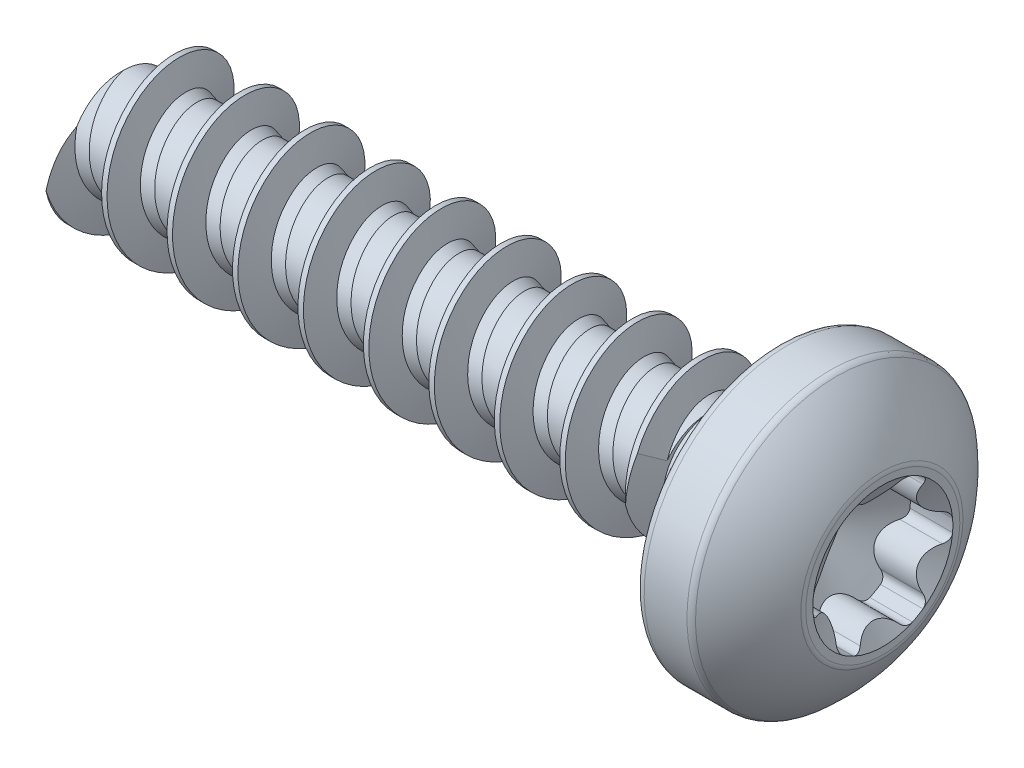
from build123d import *

# Parameters (mm, degrees)
BOSS_EXTRUDE1_REACH = 17.248
SKETCH3_R           = 1.49479
SKETCH9_W           = 11.43
SKETCH9_H           = 1.5367
CUT_SWEEP1_PITCH    = 1.27


# Read off the part's stored shape, not the designer's step: Split1
with BuildPart() as part:
    # Sketch2 → Revolve1 (revolve)
    with BuildSketch(Plane.XY):
        with BuildLine():
            Line((-7.366, 0), (7.366, 0))
            Line((7.366, 0), (7.366, 1.49479))
            ThreePointArc((7.366, 1.49479), (7.361453422, 1.535315115), (7.348039754, 1.57382524))
            ThreePointArc((7.348039754, 1.57382524), (6.966551479, 2.199326693), (6.467579747, 2.735808362))
            ThreePointArc((6.467579747, 2.735808362), (6.411371594, 2.769549597), (6.346875429, 2.7813))
            Line((6.346875429, 2.7813), (5.51688, 2.7813))
            ThreePointArc((5.51688, 2.7813), (5.387564312, 2.727735688), (5.334, 2.59842))
            Line((5.334, 2.59842), (5.334, 1.380701667))
            ThreePointArc((5.334, 1.380701667), (5.226871376, 1.12207029), (4.96824, 1.014941667))
            Line((4.96824, 1.014941667), (4.261487689, 1.014941667))
            Line((4.261487689, 1.014941667), (4.064, 0.962025))
            Line((4.064, 0.962025), (-7.366, 0.962025))
            Line((-7.366, 0.962025), (-7.366, 0))
        make_face()
    revolve(axis=Axis((-7.366, 0, 0), (-1, 0, 0)))

    # Sketch12 → Cut-Revolve3 (revolve, cut)
    with BuildSketch(Plane.XY, mode=Mode.PRIVATE) as cut_revolve3_sk:
        Polygon((7.366, 1.3589), (6.5405, 1.3589), (5.755938719, 0), (7.366, 0), align=None)
    revolve(cut_revolve3_sk.sketch.rotate(Axis((-7.366, 0, 0), (1, 0, 0)), 90), axis=Axis((-7.366, 0, 0), (1, 0, 0)), mode=Mode.SUBTRACT)

    # Boss-Extrude1: up to this cone (the profile starts inside it)
    boss_extrude1_end = Plane(origin=(7.366, 0, 0), z_dir=(1, 0, 0)).offset(-1.610060281) * Cone(1.732e-06, 38.359329517, 22.146768222, align=(Align.CENTER, Align.CENTER, Align.MIN), mode=Mode.PRIVATE)
    # Sketch3 → Boss-Extrude1 (add, up to the surface)
    with BuildSketch(Plane(origin=(7.366, 0, 0), x_dir=(0, 0, -1), z_dir=(1, 0, 0)), mode=Mode.PRIVATE) as boss_extrude1_sk1:
        Circle(SKETCH3_R)
        with BuildLine():
            ThreePointArc((0.67945, 1.176841921), (0.627470191, 1.205359021), (0.574295956, 1.231581652))
            ThreePointArc((0.574295956, 1.231581652), (0.467380243, 1.243824324), (0.374564164, 1.189363072))
            ThreePointArc((0.374564164, 1.189363072), (0, 1.019175), (-0.374564164, 1.189363072))
            ThreePointArc((-0.374564164, 1.189363072), (-0.467380243, 1.243824324), (-0.574295956, 1.231581652))
            ThreePointArc((-0.574295956, 1.231581652), (-0.627470191, 1.205359021), (-0.67945, 1.176841921))
            ThreePointArc((-0.67945, 1.176841921), (-0.730136438, 1.146084636), (-0.779433019, 1.113145713))
            ThreePointArc((-0.779433019, 1.113145713), (-0.843493341, 1.026675326), (-0.842736553, 0.919063617))
            ThreePointArc((-0.842736553, 0.919063617), (-0.882631441, 0.5095875), (-1.217300717, 0.270299455))
            ThreePointArc((-1.217300717, 0.270299455), (-1.310873584, 0.217148998), (-1.353728975, 0.118435939))
            ThreePointArc((-1.353728975, 0.118435939), (-1.357606628, 0.059274385), (-1.3589, 0))
            ThreePointArc((-1.3589, 0), (-1.357606628, -0.059274385), (-1.353728975, -0.118435939))
            ThreePointArc((-1.353728975, -0.118435939), (-1.310873584, -0.217148998), (-1.217300717, -0.270299455))
            ThreePointArc((-1.217300717, -0.270299455), (-0.882631441, -0.5095875), (-0.842736553, -0.919063617))
            ThreePointArc((-0.842736553, -0.919063617), (-0.843493341, -1.026675326), (-0.779433019, -1.113145713))
            ThreePointArc((-0.779433019, -1.113145713), (-0.730136438, -1.146084636), (-0.67945, -1.176841921))
            ThreePointArc((-0.67945, -1.176841921), (-0.627470191, -1.205359021), (-0.574295956, -1.231581652))
            ThreePointArc((-0.574295956, -1.231581652), (-0.467380243, -1.243824324), (-0.374564164, -1.189363072))
            ThreePointArc((-0.374564164, -1.189363072), (0, -1.019175), (0.374564164, -1.189363072))
            ThreePointArc((0.374564164, -1.189363072), (0.467380243, -1.243824324), (0.574295956, -1.231581652))
            ThreePointArc((0.574295956, -1.231581652), (0.627470191, -1.205359021), (0.67945, -1.176841921))
            ThreePointArc((0.67945, -1.176841921), (0.730136438, -1.146084636), (0.779433019, -1.113145713))
            ThreePointArc((0.779433019, -1.113145713), (0.843493341, -1.026675326), (0.842736553, -0.919063617))
            ThreePointArc((0.842736553, -0.919063617), (0.882631441, -0.5095875), (1.217300717, -0.270299455))
            ThreePointArc((1.217300717, -0.270299455), (1.310873584, -0.217148998), (1.353728975, -0.118435939))
            ThreePointArc((1.353728975, -0.118435939), (1.357606628, -0.059274385), (1.3589, 0))
            ThreePointArc((1.3589, 0), (1.357606628, 0.059274385), (1.353728975, 0.118435939))
            ThreePointArc((1.353728975, 0.118435939), (1.310873584, 0.217148998), (1.217300717, 0.270299455))
            ThreePointArc((1.217300717, 0.270299455), (0.882631441, 0.5095875), (0.842736553, 0.919063617))
            ThreePointArc((0.842736553, 0.919063617), (0.843493341, 1.026675326), (0.779433019, 1.113145713))
            ThreePointArc((0.779433019, 1.113145713), (0.730136438, 1.146084636), (0.67945, 1.176841921))
        make_face(mode=Mode.SUBTRACT)
    boss_extrude1_tool1 = extrude(boss_extrude1_sk1.sketch, amount=-BOSS_EXTRUDE1_REACH, mode=Mode.PRIVATE) & boss_extrude1_end
    add(boss_extrude1_tool1.solids().sort_by_distance((7.366, 0, 1.452511))[0])

    # Cut-Extrude2 cone 1 section (through the dimple's axis) → Cut-Extrude2 (revolve, cut)
    with BuildSketch(Plane(origin=(7.366, 0, 0), x_dir=(0, 0, -1), z_dir=(0, 1, 0))):
        Polygon((0, 0), (1.3589, 0), (0, 0.784561281), align=None)
    revolve(axis=Axis((7.366, 0, 0), (-1, 0, 0)), mode=Mode.SUBTRACT)

    # Split1 outline → Split1 (revolve, cut)
    with BuildSketch(Plane.YX):
        Polygon((0.962025, -7.366), (0.962025, 4.064), (0, 0.473673822), (0, -7.366), align=None)
    revolve(axis=Axis((0, 0, 0), (1, 0, 0)), mode=Mode.SUBTRACT)


with BuildPart() as body_2:
    # Split1 2 outline → Split1 2 (revolve)
    with BuildSketch(Plane.YX):
        Polygon((0.962025, -7.366), (0.962025, 4.064), (0, 0.473673822), (0, -7.366), align=None)
    revolve(axis=Axis((0, 0, 0), (1, 0, 0)))

    # Sketch9 → Revolve2 (revolve)
    with BuildSketch(Plane.XY):
        with Locations((-1.651, 0.76835)):
            Rectangle(SKETCH9_W, SKETCH9_H)
    revolve(axis=Axis((-7.366, 0, 0), (1, 0, 0)))

    # Cut-Sweep1: the profile of Sketch7 screwed along a right-hand helix of 11 turns, 8 arcs to a turn; built about Z, then put on its axis
    cut_sweep1_z = Axis((0, 0, 0), (0, 0, 1))
    cut_sweep1_corners = [(1.5367, 0, -0.464080433), (1.020990764, 0, -0.602264306), (0.962025, 0, -0.822327532), (0.962025, 0, -1.27), (1.020990764, 0, -1.490063226), (1.5367, 0, -1.628247099), (1.674181533, 0, -1.628247099), (1.674181533, 0, -0.464080433)]
    with BuildLine(mode=Mode.PRIVATE) as cut_sweep1_profile:
        Line(cut_sweep1_corners[0], cut_sweep1_corners[1])
        Line(cut_sweep1_corners[1], cut_sweep1_corners[2])
        Line(cut_sweep1_corners[2], cut_sweep1_corners[3])
        Line(cut_sweep1_corners[3], cut_sweep1_corners[4])
        Line(cut_sweep1_corners[4], cut_sweep1_corners[5])
        Line(cut_sweep1_corners[5], cut_sweep1_corners[6])
        Line(cut_sweep1_corners[6], cut_sweep1_corners[7])
        Line(cut_sweep1_corners[7], cut_sweep1_corners[0])
    cut_sweep1_cap = Face(cut_sweep1_profile.wire())
    cut_sweep1_turn_angles = [0, 22.5, 45, 67.5, 90, 112.5, 135, 157.5, 180, 202.5, 225, 247.5, 270, 292.5, 315, 337.5, 360]
    cut_sweep1_turn_weights = [1, 0.9238795325112867, 1, 0.9238795325112867, 1, 0.9238795325112867, 1, 0.9238795325112867, 1, 0.9238795325112867, 1, 0.9238795325112867, 1, 0.9238795325112867, 1, 0.9238795325112867, 1]
    cut_sweep1_turn_rails = [Edge.make_bspline([Vector(p[0], p[1], 0).rotate(cut_sweep1_z, cut_sweep1_turn_angles[k]) / cut_sweep1_turn_weights[k] + Vector(0, 0, p[2] + CUT_SWEEP1_PITCH * cut_sweep1_turn_angles[k] / 360) for k in range(17)], [0, 0, 0, 1, 1, 2, 2, 3, 3, 4, 4, 5, 5, 6, 6, 7, 7, 8, 8, 8], 2, cut_sweep1_turn_weights) for p in cut_sweep1_corners]
    cut_sweep1_turn_sides = [Face.make_surface_from_curves(cut_sweep1_turn_rails[p[0]], cut_sweep1_turn_rails[p[1]]) for p in [(0, 1), (1, 2), (2, 3), (3, 4), (4, 5), (5, 6), (6, 7), (7, 0)]]
    cut_sweep1 = Plane(origin=(-7.366, 0, 0), x_dir=(0, 1, 0), z_dir=(1, 0, 0)) * Solid(Shell([*[p.moved(Location((0, 0, CUT_SWEEP1_PITCH * i))) for i in range(11) for p in cut_sweep1_turn_sides], cut_sweep1_cap, cut_sweep1_cap.rotate(cut_sweep1_z, 3960).moved(Location((0, 0, CUT_SWEEP1_PITCH * 3960 / 360)))]))
    add(cut_sweep1, mode=Mode.SUBTRACT)

    # Sketch11 → Cut-Revolve2 (revolve, cut)
    with BuildSketch(Plane.XY):
        Polygon((4.064, 0.962025), (3.910016298, 1.5367), (4.064, 1.5367), align=None)
    revolve(axis=Axis((-7.366, 0, 0), (1, 0, 0)), mode=Mode.SUBTRACT)

    # Combine1: union part
    add(part.part)


solid = body_2.part
